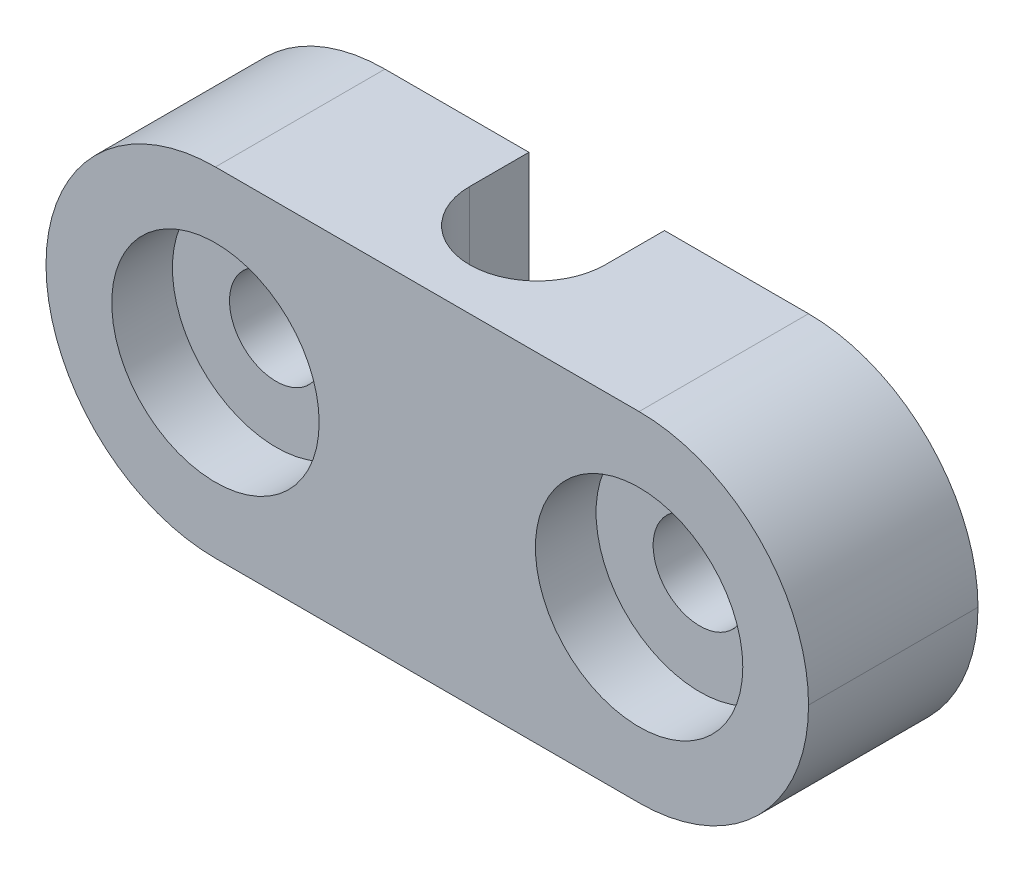
from build123d import *

# Parameters (mm, degrees)
SKETCH2_W                               = 45
SKETCH2_H                               = 20
BOSS_EXTRUDE2_DEPTH                     = 10
FILLET1_R                               = 10
CUT_EXTRUDE1_DEPTH                      = 22
CBORE_FOR_M5_HEX_HEAD_BOLT1_D           = 5.5
CBORE_FOR_M5_HEX_HEAD_BOLT1_CBORE_D     = 12.24
CBORE_FOR_M5_HEX_HEAD_BOLT1_CBORE_DEPTH = 3.58


with BuildPart() as part:
    # Sketch2 → Boss-Extrude2 (new body)
    with BuildSketch(Plane.XY):
        Rectangle(SKETCH2_W, SKETCH2_H)
    extrude(amount=BOSS_EXTRUDE2_DEPTH)

    # Fillet1
    fillet1_edges = [part.edges().sort_by_distance(p)[0] for p in [
        (22.5, 10, 5),
        (22.5, -10, 5),
        (-22.5, 10, 5),
        (-22.5, -10, 5),
    ]]
    fillet(fillet1_edges, radius=FILLET1_R - 0.0001)  # a hair under: the kernel refuses the full size

    # Sketch3 → Cut-Extrude1 (cut)
    with BuildSketch(Plane.XZ.offset(10)):
        with BuildLine():
            Line((-4, 0), (-4, 3.5))
            ThreePointArc((-4, 3.5), (0, 7.5), (4, 3.5))
            Line((4, 3.5), (4, 0))
            ThreePointArc((4, 0), (0, -4), (-4, 0))
        make_face()
    extrude(amount=-CUT_EXTRUDE1_DEPTH, mode=Mode.SUBTRACT)

    # CBORE for M5 Hex Head Bolt1 (through all)
    with Locations(Plane.XY.offset(10)):
        with Locations((-12.5, 0), (12.5, 0)):
            CounterBoreHole(CBORE_FOR_M5_HEX_HEAD_BOLT1_D / 2, CBORE_FOR_M5_HEX_HEAD_BOLT1_CBORE_D / 2, CBORE_FOR_M5_HEX_HEAD_BOLT1_CBORE_DEPTH)


solid = part.part
